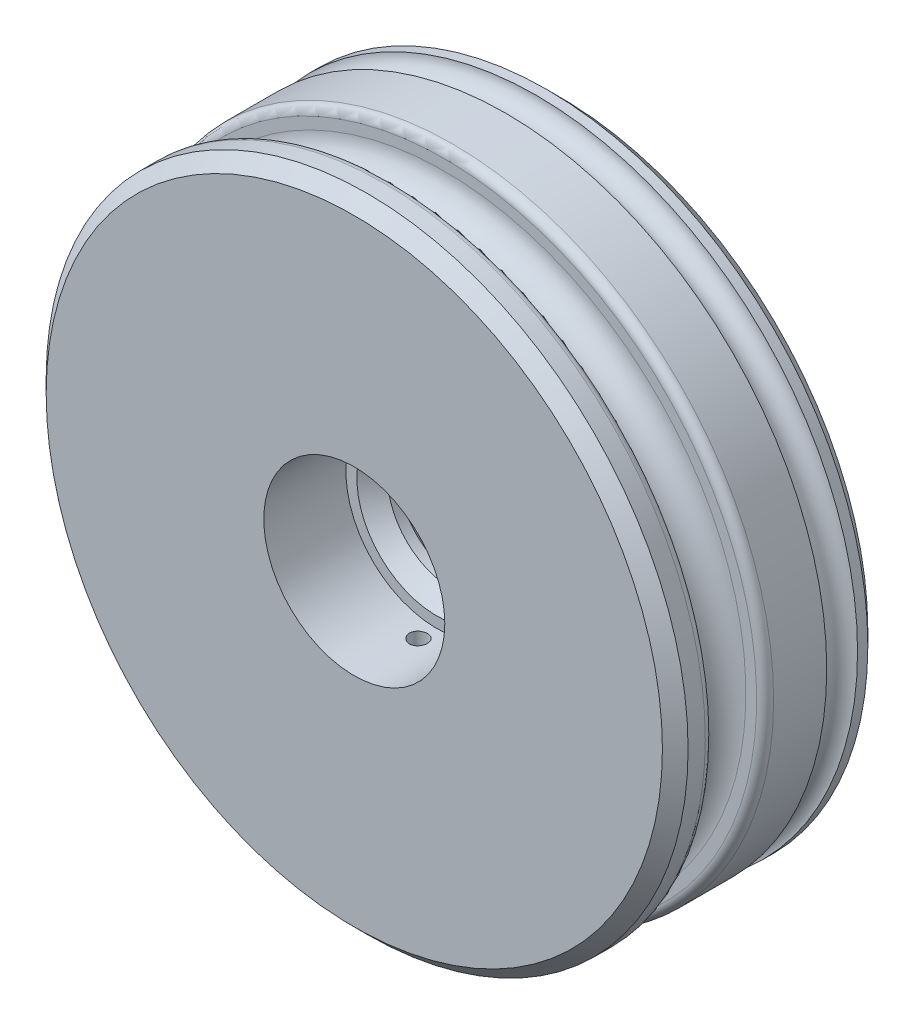
from build123d import *

# Parameters (mm, degrees)
SKETCH1_R                = 12.5
BOSS_EXTRUDE1_DEPTH      = 4
SKETCH2_R                = 3.525
CUT_EXTRUDE1_DEPTH       = 3.2
CHAMFER1_SIZE            = 0.5
SKETCH4_R                = 2.5
CUT_EXTRUDE2_DEPTH       = 18.964965906
CHAMFER2_SIZE            = 0.6
CHAMFER1_OF_MIRROR2_SIZE = 0.5
CHAMFER2_OF_MIRROR2_SIZE = 0.6
SKETCH7_R                = 0.6
FILLET1_R                = 0.33
SKETCH8_R                = 0.35
CUT_EXTRUDE3_DEPTH       = 19.124569098


with BuildPart() as part:
    # Sketch1 → Boss-Extrude1 (new body)
    with BuildSketch(Plane.XY):
        Circle(SKETCH1_R)
    boss_extrude1 = extrude(amount=BOSS_EXTRUDE1_DEPTH)

    # Sketch3 → Cut-Revolve1 (revolve, cut)
    with BuildSketch(Plane(origin=(0, 0, 0), x_dir=(0, 0, -1), z_dir=(1, 0, 0))):
        with BuildLine():
            Line((-2.5, 11.75), (-2.5, 12.75))
            Line((-2.5, 12.75), (-0.5, 12.75))
            Line((-0.5, 12.75), (-0.5, 11.75))
            ThreePointArc((-0.5, 11.75), (-1.5, 10.75), (-2.5, 11.75))
        make_face()
    revolve(axis=Axis((0, 0, -0.35), (0, 0, 1)), mode=Mode.SUBTRACT)

    # Sketch2 → Cut-Extrude1 (cut)
    with BuildSketch(Plane.XY.offset(4)):
        Circle(SKETCH2_R)
    cut_extrude1 = extrude(amount=-CUT_EXTRUDE1_DEPTH, mode=Mode.SUBTRACT)

    # Chamfer1
    chamfer1_edges = [part.edges().sort_by_distance(p)[0] for p in [
        (-12.5, 0, 4),
    ]]
    chamfer(chamfer1_edges, length=CHAMFER1_SIZE)

    # Sketch4 → Cut-Extrude2 (cut, through all)
    with BuildSketch(Plane.XY.offset(0.8)):
        Circle(SKETCH4_R)
    cut_extrude2 = extrude(amount=-CUT_EXTRUDE2_DEPTH, mode=Mode.SUBTRACT)

    # Chamfer2
    chamfer2_edges = [part.edges().sort_by_distance(p)[0] for p in [
        (-2.5, 0, 0.8),
    ]]
    chamfer(chamfer2_edges, length=CHAMFER2_SIZE)

    # Mirror2: Boss-Extrude1, Cut-Extrude1, Cut-Extrude2 across plane
    add(boss_extrude1.mirror(Plane.XY))
    add(cut_extrude1.mirror(Plane.XY), mode=Mode.SUBTRACT)
    add(cut_extrude2.mirror(Plane.XY), mode=Mode.SUBTRACT)

    # Chamfer1 of Mirror2
    chamfer1_of_mirror2_edges = [part.edges().sort_by_distance(p)[0] for p in [
        (-12.5, 0, -4),
    ]]
    chamfer(chamfer1_of_mirror2_edges, length=CHAMFER1_OF_MIRROR2_SIZE)

    # Chamfer2 of Mirror2
    chamfer2_of_mirror2_edges = [part.edges().sort_by_distance(p)[0] for p in [
        (-2.5, 0, -0.8),
    ]]
    chamfer(chamfer2_of_mirror2_edges, length=CHAMFER2_OF_MIRROR2_SIZE)

    # Sketch7 → Cut-Revolve3 (revolve, cut)
    with BuildSketch(Plane(origin=(0, 0, 0), x_dir=(0, 0, -1), z_dir=(1, 0, 0))):
        with Locations((2.5, 12.5)):
            Circle(SKETCH7_R)
    revolve(axis=Axis((0, 0, -0.35), (0, 0, 1)), mode=Mode.SUBTRACT)

    # Fillet1
    fillet1_edges = [part.edges().sort_by_distance(p)[0] for p in [
        (-12.5, 0, 2.5),
        (-12.5, 0, 0.5),
    ]]
    fillet(fillet1_edges, radius=FILLET1_R)

    # Sketch8 → Cut-Extrude3 (cut, through all)
    with BuildSketch(Plane(origin=(0, 0, 0), x_dir=(1, 0, 0), z_dir=(0, 1, 0))):
        with Locations((0, -1.5)):
            Circle(SKETCH8_R)
    extrude(amount=-CUT_EXTRUDE3_DEPTH, mode=Mode.SUBTRACT)


solid = part.part
